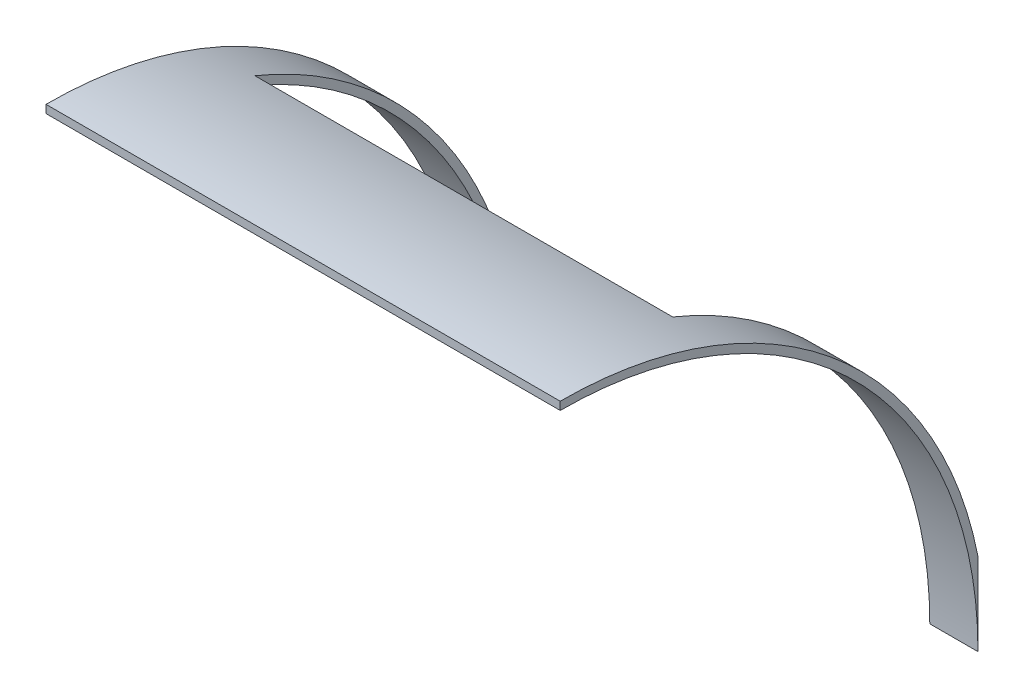
from build123d import *

# Parameters (mm, degrees)
SKETCH1_W          = 203.2
SKETCH1_H          = 3.175
REVOLVE1_ANGLE     = 90
SKETCH2_W          = 203.2
SKETCH2_H          = 3.175
CUT_EXTRUDE1_DEPTH = 313.926814527
SKETCH3_W          = 165.1
SKETCH3_H          = 101.6
CUT_EXTRUDE2_DEPTH = 312.230984359


# Read off the part's stored shape, not the designer's step: #10 Clearance Hole1
with BuildPart() as part:
    # Sketch1 → Revolve1 (revolve)
    with BuildSketch(Plane.XY):
        with Locations((-101.6, 19.434848485)):
            Rectangle(SKETCH1_W, SKETCH1_H)
    revolve(axis=Axis((-168.467424242, -147.252651515, 0), (-1, 0, 0)), revolution_arc=REVOLVE1_ANGLE)

    # Sketch2 → Cut-Extrude1 (cut, through all)
    with BuildSketch(Plane(origin=(0, -147.252651515, 0), x_dir=(-1, 0, 0), z_dir=(0, -1, 0))):
        with Locations((101.6, 166.6875)):
            Rectangle(SKETCH2_W, SKETCH2_H)
    extrude(amount=-CUT_EXTRUDE1_DEPTH, mode=Mode.SUBTRACT)

    # Sketch3 → Cut-Extrude2 (cut, through all)
    with BuildSketch(Plane.XZ.offset(147.252651515)):
        with Locations((-101.6, -114.3)):
            Rectangle(SKETCH3_W, SKETCH3_H)
    extrude(amount=-CUT_EXTRUDE2_DEPTH, mode=Mode.SUBTRACT)

    # #10 Clearance Hole1 outline → #10 Clearance Hole1 (revolve, cut)
    with BuildSketch(Plane(origin=(-63.5, -15.166166065, -37.2189581), x_dir=(1, 0, 0), z_dir=(0, 0.3773584905660381, 0.9260672597590962))):
        Polygon((2.5527, 30.49567621), (0, 30.49567621), (0, 27.797130409), (2.187572038, 27.797130409), (2.5527, 28.016521422), align=None)
    revolve(axis=Axis((-63.5, -15.166166065, -37.2189581), (0, 0.9260672597590962, -0.3773584905660381)), mode=Mode.SUBTRACT)

    # 10 Clearance Hole1 2 outline → 10 Clearance Hole1 2 (revolve, cut)
    with BuildSketch(Plane(origin=(-114.3, -15.166166065, -37.2189581), x_dir=(1, 0, 0), z_dir=(0, 0.3773584905660381, 0.9260672597590962))):
        Polygon((0, 30.49567621), (0, 27.797130409), (2.187572038, 27.797130409), (2.5527, 28.016521422), (2.5527, 30.49567621), align=None)
    revolve(axis=Axis((-114.3, -15.166166065, -37.2189581), (0, 0.9260672597590962, -0.3773584905660381)), mode=Mode.SUBTRACT)


solid = part.part
